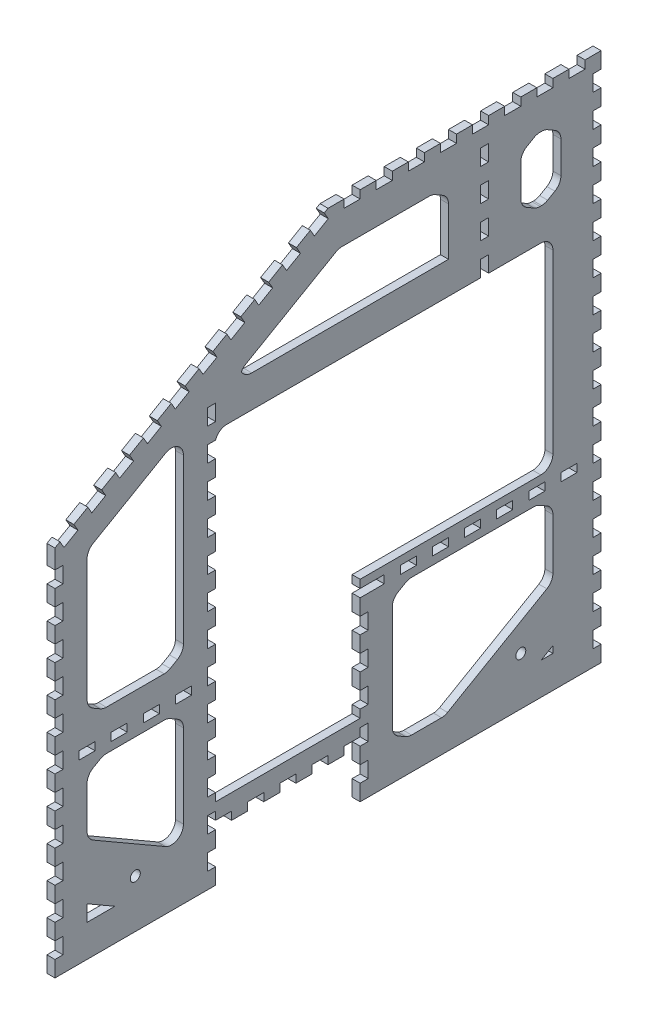
from build123d import *
from OCP.BRepFilletAPI import BRepFilletAPI_MakeChamfer

# Parameters (mm, degrees)
BOSS_EXTRUDE1_DEPTH  = 6.35
SKETCH3_R            = 3.96875
CUT_EXTRUDE1_DEPTH   = 602.77767697
SKETCH5_W            = 6.35
SKETCH5_H            = 12.7
CUT_EXTRUDE3_DEPTH   = 602.77767697
LPATTERN1_COUNT      = 16
LPATTERN1_PITCH      = 25.4
SKETCH6_W            = 6.35
SKETCH6_H            = 12.7
CUT_EXTRUDE4_DEPTH   = 602.77767697
LPATTERN2_COUNT      = 11
LPATTERN2_PITCH      = 25.4
SKETCH7_W            = 6.35
SKETCH7_H            = 12.7
SKETCH7_W_2          = 12.7
SKETCH7_H_2          = 6.35
CUT_EXTRUDE5_DEPTH   = 602.77767697
CUT_EXTRUDE6_DEPTH   = 602.77767697
LPATTERN3_COUNT      = 10
LPATTERN3_PITCH      = 25.4
SKETCH9_W            = 12.7
SKETCH9_H            = 6.35
CUT_EXTRUDE7_DEPTH   = 602.77767697
LPATTERN4_COUNT      = 8
LPATTERN4_PITCH      = 25.4
SKETCH10_R           = 3.175
CUT_EXTRUDE8_DEPTH   = 602.77767697
SKETCH11_R           = 3.96875
CUT_EXTRUDE9_DEPTH   = 602.77767697
SKETCH12_W           = 6.35
SKETCH12_H           = 12.7
CUT_EXTRUDE13_DEPTH  = 602.77767697
SKETCH17_W           = 12.7
SKETCH17_H           = 6.35
CUT_EXTRUDE17_DEPTH  = 602.77767697
LPATTERN5_COUNT      = 17
LPATTERN5_PITCH      = 25.4
LPATTERN6_COUNT      = 2
LPATTERN6_PITCH      = 120.65
SKETCH18_W           = 12.7
SKETCH18_H           = 6.35
CUT_EXTRUDE18_DEPTH  = 602.77767697
LPATTERN7_COUNT      = 5
LPATTERN7_PITCH      = 25.4
CUT_EXTRUDE19_DEPTH  = 602.77767697
SKETCH20_W           = 101.6
SKETCH20_H           = 57.15
CUT_EXTRUDE20_DEPTH  = 602.77767697
CUT_EXTRUDE21_DEPTH  = 602.77767697
CUT_EXTRUDE22_DEPTH  = 602.77767697
SKETCH29_W           = 114.3
SKETCH29_H           = 95.25
CUT_EXTRUDE24_DEPTH  = 602.77767697
SKETCH30_W           = 25.4
SKETCH30_H           = 173.344167394
BOSS_EXTRUDE5_DEPTH  = 6.35
SKETCH31_W           = 6.35
SKETCH31_H           = 12.7
CUT_EXTRUDE25_DEPTH  = 602.77767697
SKETCH33_W           = 114.3
SKETCH33_H           = 12.7
CUT_EXTRUDE27_DEPTH  = 602.77767697
SKETCH34_W           = 114.3
SKETCH34_H           = 12.7
BOSS_EXTRUDE6_DEPTH  = 6.35
SKETCH35_W           = 152.4
SKETCH35_H           = 19.05
CUT_EXTRUDE28_DEPTH  = 602.77767697
BOSS_EXTRUDE8_DEPTH  = 6.35
SKETCH37_W           = 6.35
SKETCH37_H           = 12.7
CUT_EXTRUDE29_DEPTH  = 602.77767697
LPATTERN8_COUNT      = 5
LPATTERN8_PITCH      = 25.4
SKETCH38_W           = 31.75
SKETCH38_H           = 50.8
CUT_EXTRUDE30_DEPTH  = 602.77767697
CHAMFER1_SIZE        = 12.7
CHAMFER1_SIZE2       = 7.332348419
CHAMFER2_SIZE        = 12.7
CHAMFER2_SIZE2       = 7.332348419
BOSS_EXTRUDE9_DEPTH  = 6.35
SKETCH40_W           = 165.1
SKETCH40_H           = 6.35
BOSS_EXTRUDE10_DEPTH = 6.35
SKETCH41_W           = 12.7
SKETCH41_H           = 7.332348419
CUT_EXTRUDE31_DEPTH  = 602.77767697
FILLET1_DEPTH        = 6.35


with BuildPart() as part:
    # Sketch2 → Boss-Extrude1 (new body)
    with BuildSketch(Plane(origin=(0, 0, 0), x_dir=(0, 0, -1), z_dir=(1, 0, 0))):
        Polygon((0, 0), (0, 294.450076882), (215.9, 419.1), (431.8, 419.1), (431.8, 0), (241.3, 0), (241.3, 38.1), (127, 38.1), (127, 0), align=None)
    extrude(amount=BOSS_EXTRUDE1_DEPTH)

    # Sketch3 → Cut-Extrude1 (cut, through all)
    with BuildSketch(Plane(origin=(6.35, 0, 0), x_dir=(0, 0, -1), z_dir=(1, 0, 0))):
        with Locations((63.5, 38.1)):
            Circle(SKETCH3_R)
        with Locations((368.3, 38.1)):
            Circle(SKETCH3_R)
    extrude(amount=-CUT_EXTRUDE1_DEPTH, mode=Mode.SUBTRACT)

    # Sketch5 → Cut-Extrude3 (cut, through all)
    with BuildSketch(Plane(origin=(6.35, 0, 0), x_dir=(0, 0, -1), z_dir=(1, 0, 0))):
        with Locations((428.625, 19.05)):
            Rectangle(SKETCH5_W, SKETCH5_H)
    cut_extrude3 = extrude(amount=-CUT_EXTRUDE3_DEPTH, mode=Mode.SUBTRACT)

    # LPattern1: Cut-Extrude3 ×16
    with Locations(*[(0, i * LPATTERN1_PITCH, 0) for i in range(1, LPATTERN1_COUNT)]):
        add(cut_extrude3, mode=Mode.SUBTRACT)

    # Sketch6 → Cut-Extrude4 (cut, through all)
    with BuildSketch(Plane(origin=(6.35, 0, 0), x_dir=(0, 0, -1), z_dir=(1, 0, 0))):
        with Locations((3.175, 19.05)):
            Rectangle(SKETCH6_W, SKETCH6_H)
    cut_extrude4 = extrude(amount=-CUT_EXTRUDE4_DEPTH, mode=Mode.SUBTRACT)

    # LPattern2: Cut-Extrude4 ×11
    with Locations(*[(0, i * LPATTERN2_PITCH, 0) for i in range(1, LPATTERN2_COUNT)]):
        add(cut_extrude4, mode=Mode.SUBTRACT)

    # Sketch7 → Cut-Extrude5 (cut, through all)
    with BuildSketch(Plane(origin=(6.35, 0, 0), x_dir=(0, 0, -1), z_dir=(1, 0, 0))):
        with Locations((123.825, 19.05)):
            Rectangle(SKETCH7_W, SKETCH7_H)
        with Locations((133.35, 41.275)):
            Rectangle(SKETCH7_W_2, SKETCH7_H_2)
        with Locations((158.75, 41.275)):
            Rectangle(SKETCH7_W_2, SKETCH7_H_2)
        with Locations((184.15, 41.275)):
            Rectangle(SKETCH7_W_2, SKETCH7_H_2)
        with Locations((244.475, 19.05)):
            Rectangle(SKETCH7_W, SKETCH7_H)
        with Locations((209.55, 41.275)):
            Rectangle(SKETCH7_W_2, SKETCH7_H_2)
        with Locations((234.95, 41.275)):
            Rectangle(SKETCH7_W_2, SKETCH7_H_2)
    extrude(amount=-CUT_EXTRUDE5_DEPTH, mode=Mode.SUBTRACT)

    # Sketch8 → Cut-Extrude6 (cut, through all)
    with BuildSketch(Plane(origin=(6.35, 0, 0), x_dir=(0, 0, -1), z_dir=(1, 0, 0))):
        Polygon((201.93507044, 411.037344159), (212.933593068, 417.387344159), (216.108593068, 411.888082845), (205.11007044, 405.538082845), align=None)
    cut_extrude6 = extrude(amount=-CUT_EXTRUDE6_DEPTH, mode=Mode.SUBTRACT)

    # LPattern3: Cut-Extrude6 ×10
    with Locations(*[Vector(0, -0.49999999999999933, 0.866025403784439) * (i * LPATTERN3_PITCH) for i in range(1, LPATTERN3_COUNT)]):
        add(cut_extrude6, mode=Mode.SUBTRACT)

    # Sketch9 → Cut-Extrude7 (cut, through all)
    with BuildSketch(Plane(origin=(6.35, 0, 0), x_dir=(0, 0, -1), z_dir=(1, 0, 0))):
        with Locations((412.75, 415.925)):
            Rectangle(SKETCH9_W, SKETCH9_H)
    cut_extrude7 = extrude(amount=-CUT_EXTRUDE7_DEPTH, mode=Mode.SUBTRACT)

    # LPattern4: Cut-Extrude7 ×8
    with Locations(*[(0, 0, i * LPATTERN4_PITCH) for i in range(1, LPATTERN4_COUNT)]):
        add(cut_extrude7, mode=Mode.SUBTRACT)

    # Sketch10 → Cut-Extrude8 (cut, through all)
    with BuildSketch(Plane(origin=(6.35, 0, 0), x_dir=(0, 0, -1), z_dir=(1, 0, 0))):
        with Locations((222.25, 273.05)):
            Circle(SKETCH10_R)
        with Locations((222.25, 57.15)):
            Circle(SKETCH10_R)
        with Locations((146.05, 57.15)):
            Circle(SKETCH10_R)
        with Locations((146.05, 273.05)):
            Circle(SKETCH10_R)
    extrude(amount=-CUT_EXTRUDE8_DEPTH, mode=Mode.SUBTRACT)

    # Sketch11 → Cut-Extrude9 (cut, through all)
    with BuildSketch(Plane(origin=(6.35, 0, 0), x_dir=(0, 0, -1), z_dir=(1, 0, 0))):
        with Locations((38.1, 260.35)):
            Circle(SKETCH11_R)
        with Locations((266.7, 260.35)):
            Circle(SKETCH11_R)
    extrude(amount=-CUT_EXTRUDE9_DEPTH, mode=Mode.SUBTRACT)

    # Sketch12 → Cut-Extrude13 (cut, through all)
    with BuildSketch(Plane(origin=(6.35, 0, 0), x_dir=(0, 0, -1), z_dir=(1, 0, 0))):
        with Locations((123.825, 44.45)):
            Rectangle(SKETCH12_W, SKETCH12_H)
        with Locations((123.825, 69.85)):
            Rectangle(SKETCH12_W, SKETCH12_H)
        with Locations((123.825, 95.25)):
            Rectangle(SKETCH12_W, SKETCH12_H)
        with Locations((123.825, 120.65)):
            Rectangle(SKETCH12_W, SKETCH12_H)
        with Locations((123.825, 146.05)):
            Rectangle(SKETCH12_W, SKETCH12_H)
        with Locations((123.825, 171.45)):
            Rectangle(SKETCH12_W, SKETCH12_H)
        with Locations((123.825, 196.85)):
            Rectangle(SKETCH12_W, SKETCH12_H)
        with Locations((123.825, 222.25)):
            Rectangle(SKETCH12_W, SKETCH12_H)
        with Locations((123.825, 247.65)):
            Rectangle(SKETCH12_W, SKETCH12_H)
        with Locations((123.825, 273.05)):
            Rectangle(SKETCH12_W, SKETCH12_H)
        with Locations((123.825, 298.45)):
            Rectangle(SKETCH12_W, SKETCH12_H)
        with Locations((123.825, 323.85)):
            Rectangle(SKETCH12_W, SKETCH12_H)
    cut_extrude13 = extrude(amount=-CUT_EXTRUDE13_DEPTH, mode=Mode.SUBTRACT)

    # Sketch17 → Cut-Extrude17 (cut, through all)
    with BuildSketch(Plane(origin=(6.35, 0, 0), x_dir=(0, 0, -1), z_dir=(1, 0, 0))):
        with Locations((25.4, 142.875)):
            Rectangle(SKETCH17_W, SKETCH17_H)
    cut_extrude17 = extrude(amount=-CUT_EXTRUDE17_DEPTH, mode=Mode.SUBTRACT)

    # LPattern5: Cut-Extrude17 ×17
    with Locations(*[(0, 0, -i * LPATTERN5_PITCH) for i in range(1, LPATTERN5_COUNT)]):
        add(cut_extrude17, mode=Mode.SUBTRACT)

    # LPattern6: Cut-Extrude13 ×2
    with Locations(*[(0, 0, -i * LPATTERN6_PITCH) for i in range(1, LPATTERN6_COUNT)]):
        add(cut_extrude13, mode=Mode.SUBTRACT)

    # Sketch18 → Cut-Extrude18 (cut, through all)
    with BuildSketch(Plane(origin=(6.35, 0, 0), x_dir=(0, 0, -1), z_dir=(1, 0, 0))):
        with Locations((133.35, 117.475)):
            Rectangle(SKETCH18_W, SKETCH18_H)
    cut_extrude18 = extrude(amount=-CUT_EXTRUDE18_DEPTH, mode=Mode.SUBTRACT)

    # LPattern7: Cut-Extrude18 ×5
    with Locations(*[(0, 0, -i * LPATTERN7_PITCH) for i in range(1, LPATTERN7_COUNT)]):
        add(cut_extrude18, mode=Mode.SUBTRACT)

    # Sketch19 → Cut-Extrude19 (cut, through all)
    with BuildSketch(Plane(origin=(6.35, 0, 0), x_dir=(0, 0, -1), z_dir=(1, 0, 0))):
        Polygon((25.4, 279.785380045), (222.705909488, 393.7), (393.7, 393.7), (393.7, 165.1), (25.4, 165.1), align=None)
    extrude(amount=-CUT_EXTRUDE19_DEPTH, mode=Mode.SUBTRACT)

    # Sketch20 → Cut-Extrude20 (cut, through all)
    with BuildSketch(Plane(origin=(6.35, 0, 0), x_dir=(0, 0, -1), z_dir=(1, 0, 0))):
        with Locations((184.15, 79.375)):
            Rectangle(SKETCH20_W, SKETCH20_H)
    extrude(amount=-CUT_EXTRUDE20_DEPTH, mode=Mode.SUBTRACT)

    # Sketch21 → Cut-Extrude21 (cut, through all)
    with BuildSketch(Plane(origin=(6.35, 0, 0), x_dir=(0, 0, -1), z_dir=(1, 0, 0))):
        Polygon((266.7, 25.4), (308.202954744, 25.4), (393.7, 74.761742094), (393.7, 133.35), (266.7, 133.35), align=None)
        Polygon((25.4, 133.35), (25.4, 82.094090512), (101.6, 38.1), (101.6, 133.35), align=None)
        Polygon((25.4, 38.1), (25.4, 25.4), (47.397045256, 25.4), align=None)
    extrude(amount=-CUT_EXTRUDE21_DEPTH, mode=Mode.SUBTRACT)

    # Sketch22 → Cut-Extrude22 (cut, through all)
    with BuildSketch(Plane(origin=(6.35, 0, 0), x_dir=(0, 0, -1), z_dir=(1, 0, 0))):
        Polygon((384.402954744, 25.4), (393.7, 30.767651581), (393.7, 25.4), align=None)
    extrude(amount=-CUT_EXTRUDE22_DEPTH, mode=Mode.SUBTRACT)

    # Sketch29 → Cut-Extrude24 (cut, through all)
    with BuildSketch(Plane(origin=(6.35, 0, 0), x_dir=(0, 0, -1), z_dir=(1, 0, 0))):
        with Locations((184.15, 117.475)):
            Rectangle(SKETCH29_W, SKETCH29_H)
    extrude(amount=-CUT_EXTRUDE24_DEPTH, mode=Mode.SUBTRACT)

    # Sketch30 → Boss-Extrude5 (add, through all)
    with BuildSketch(Plane(origin=(6.35, 0, 0), x_dir=(0, 0, -1), z_dir=(1, 0, 0))):
        with Locations((114.3, 251.772083697)):
            Rectangle(SKETCH30_W, SKETCH30_H)
    extrude(amount=-BOSS_EXTRUDE5_DEPTH)

    # Sketch31 → Cut-Extrude25 (cut, through all)
    with BuildSketch(Plane(origin=(6.35, 0, 0), x_dir=(0, 0, -1), z_dir=(1, 0, 0))):
        with Locations((123.825, 171.45)):
            Rectangle(SKETCH31_W, SKETCH31_H)
        with Locations((123.825, 146.05)):
            Rectangle(SKETCH31_W, SKETCH31_H)
        with Locations((123.825, 196.85)):
            Rectangle(SKETCH31_W, SKETCH31_H)
        with Locations((123.825, 222.25)):
            Rectangle(SKETCH31_W, SKETCH31_H)
        with Locations((123.825, 247.65)):
            Rectangle(SKETCH31_W, SKETCH31_H)
        with Locations((123.825, 273.05)):
            Rectangle(SKETCH31_W, SKETCH31_H)
        with Locations((123.825, 298.45)):
            Rectangle(SKETCH31_W, SKETCH31_H)
        with Locations((123.825, 323.85)):
            Rectangle(SKETCH31_W, SKETCH31_H)
    extrude(amount=-CUT_EXTRUDE25_DEPTH, mode=Mode.SUBTRACT)

    # Sketch33 → Cut-Extrude27 (cut, through all)
    with BuildSketch(Plane(origin=(6.35, 0, 0), x_dir=(0, 0, -1), z_dir=(1, 0, 0))):
        with Locations((184.15, 63.5)):
            Rectangle(SKETCH33_W, SKETCH33_H)
    extrude(amount=-CUT_EXTRUDE27_DEPTH, mode=Mode.SUBTRACT)

    # Sketch34 → Boss-Extrude6 (add, through all)
    with BuildSketch(Plane(origin=(6.35, 0, 0), x_dir=(0, 0, -1), z_dir=(1, 0, 0))):
        with Locations((184.15, 50.8)):
            Rectangle(SKETCH34_W, SKETCH34_H)
    extrude(amount=-BOSS_EXTRUDE6_DEPTH)

    # Sketch35 → Cut-Extrude28 (cut, through all)
    with BuildSketch(Plane(origin=(6.35, 0, 0), x_dir=(0, 0, -1), z_dir=(1, 0, 0))):
        with Locations((317.5, 155.575)):
            Rectangle(SKETCH35_W, SKETCH35_H)
    extrude(amount=-CUT_EXTRUDE28_DEPTH, mode=Mode.SUBTRACT)

    # Sketch36 → Boss-Extrude8 (add, through all)
    with BuildSketch(Plane(origin=(6.35, 0, 0), x_dir=(0, 0, -1), z_dir=(1, 0, 0))):
        Polygon((127, 311.15), (393.7, 311.15), (393.7, 393.7), (222.705909488, 393.7), (127, 338.444167394), align=None)
    extrude(amount=-BOSS_EXTRUDE8_DEPTH)

    # Sketch37 → Cut-Extrude29 (cut, through all)
    with BuildSketch(Plane(origin=(6.35, 0, 0), x_dir=(0, 0, -1), z_dir=(1, 0, 0))):
        with Locations((339.725, 393.7)):
            Rectangle(SKETCH37_W, SKETCH37_H)
    cut_extrude29 = extrude(amount=-CUT_EXTRUDE29_DEPTH, mode=Mode.SUBTRACT)

    # LPattern8: Cut-Extrude29 ×5
    with Locations(*[(0, -i * LPATTERN8_PITCH, 0) for i in range(1, LPATTERN8_COUNT)]):
        add(cut_extrude29, mode=Mode.SUBTRACT)

    # Sketch38 → Cut-Extrude30 (cut, through all)
    with BuildSketch(Plane(origin=(6.35, 0, 0), x_dir=(0, 0, -1), z_dir=(1, 0, 0))):
        Polygon((136.419205835, 336.55), (224.40738686, 387.35), (311.15, 387.35), (311.15, 336.55), align=None)
        with Locations((384.175, 361.95)):
            Rectangle(SKETCH38_W, SKETCH38_H)
    extrude(amount=-CUT_EXTRUDE30_DEPTH, mode=Mode.SUBTRACT)

    # Chamfer1: one chamfer whose edges measure the first distance from different faces: ONE call of the kernel's chamfer builder (chamfer() names one face for all edges)
    chamfer1_edges_1 = [part.edges().sort_by_distance(p)[0] for p in [
        (3.175, 133.35, -266.7),
    ]]
    chamfer1_side_1 = [part.faces().sort_by_distance(p)[0] for p in [
        (3.175, 133.35, -330.2),
    ]]
    chamfer1_edges_2 = [part.edges().sort_by_distance(p)[0] for p in [
        (3.175, 133.35, -25.4),
    ]]
    chamfer1_side_2 = [part.faces().sort_by_distance(p)[0] for p in [
        (3.175, 133.35, -63.5),
    ]]
    chamfer1_edges_3 = [part.edges().sort_by_distance(p)[0] for p in [
        (3.175, 165.1, -101.6),
    ]]
    chamfer1_side_3 = [part.faces().sort_by_distance(p)[0] for p in [
        (3.175, 165.1, -63.5),
    ]]
    chamfer1_edges_4 = [part.edges().sort_by_distance(p)[0] for p in [
        (3.175, 336.55, -311.15),
    ]]
    chamfer1_side_4 = [part.faces().sort_by_distance(p)[0] for p in [
        (3.175, 336.55, -223.784602918),
    ]]
    chamfer1_edges_5 = [part.edges().sort_by_distance(p)[0] for p in [
        (3.175, 387.35, -368.3),
    ]]
    chamfer1_side_5 = [part.faces().sort_by_distance(p)[0] for p in [
        (3.175, 387.35, -384.175),
    ]]
    chamfer1_edges_6 = [part.edges().sort_by_distance(p)[0] for p in [
        (3.175, 336.55, -400.05),
    ]]
    chamfer1_side_6 = [part.faces().sort_by_distance(p)[0] for p in [
        (3.175, 336.55, -384.175),
    ]]
    chamfer1 = BRepFilletAPI_MakeChamfer(part.part.solid().wrapped)
    for e in chamfer1_edges_1:
        chamfer1.Add(CHAMFER1_SIZE, CHAMFER1_SIZE2, e.wrapped, chamfer1_side_1[0].wrapped)  # the first distance lies on this face
    for e in chamfer1_edges_2:
        chamfer1.Add(CHAMFER1_SIZE, CHAMFER1_SIZE2, e.wrapped, chamfer1_side_2[0].wrapped)  # the first distance lies on this face
    for e in chamfer1_edges_3:
        chamfer1.Add(CHAMFER1_SIZE, CHAMFER1_SIZE2, e.wrapped, chamfer1_side_3[0].wrapped)  # the first distance lies on this face
    for e in chamfer1_edges_4:
        chamfer1.Add(CHAMFER1_SIZE, CHAMFER1_SIZE2, e.wrapped, chamfer1_side_4[0].wrapped)  # the first distance lies on this face
    for e in chamfer1_edges_5:
        chamfer1.Add(CHAMFER1_SIZE, CHAMFER1_SIZE2, e.wrapped, chamfer1_side_5[0].wrapped)  # the first distance lies on this face
    for e in chamfer1_edges_6:
        chamfer1.Add(CHAMFER1_SIZE, CHAMFER1_SIZE2, e.wrapped, chamfer1_side_6[0].wrapped)  # the first distance lies on this face
    add(Compound.cast(chamfer1.Shape()), mode=Mode.REPLACE)

    # Chamfer2: one chamfer whose edges measure the first distance from different faces: ONE call of the kernel's chamfer builder (chamfer() names one face for all edges)
    chamfer2_edges_1 = [part.edges().sort_by_distance(p)[0] for p in [
        (3.175, 165.1, -25.4),
    ]]
    chamfer2_side_1 = [part.faces().sort_by_distance(p)[0] for p in [
        (3.175, 165.1, -57.15),
    ]]
    chamfer2_edges_2 = [part.edges().sort_by_distance(p)[0] for p in [
        (3.175, 25.4, -266.7),
    ]]
    chamfer2_side_2 = [part.faces().sort_by_distance(p)[0] for p in [
        (3.175, 25.4, -287.451477372),
    ]]
    chamfer2_edges_3 = [part.edges().sort_by_distance(p)[0] for p in [
        (3.175, 133.35, -393.7),
    ]]
    chamfer2_side_3 = [part.faces().sort_by_distance(p)[0] for p in [
        (3.175, 133.35, -336.55),
    ]]
    chamfer2_edges_4 = [part.edges().sort_by_distance(p)[0] for p in [
        (3.175, 133.35, -101.6),
    ]]
    chamfer2_side_4 = [part.faces().sort_by_distance(p)[0] for p in [
        (3.175, 133.35, -69.85),
    ]]
    chamfer2_edges_5 = [part.edges().sort_by_distance(p)[0] for p in [
        (3.175, 387.35, -311.15),
    ]]
    chamfer2_side_5 = [part.faces().sort_by_distance(p)[0] for p in [
        (3.175, 387.35, -267.77869343),
    ]]
    chamfer2_edges_6 = [part.edges().sort_by_distance(p)[0] for p in [
        (3.175, 387.35, -400.05),
    ]]
    chamfer2_side_6 = [part.faces().sort_by_distance(p)[0] for p in [
        (3.175, 387.35, -390.525),
    ]]
    chamfer2_edges_7 = [part.edges().sort_by_distance(p)[0] for p in [
        (3.175, 336.55, -368.3),
    ]]
    chamfer2_side_7 = [part.faces().sort_by_distance(p)[0] for p in [
        (3.175, 336.55, -377.825),
    ]]
    chamfer2 = BRepFilletAPI_MakeChamfer(part.part.solid().wrapped)
    for e in chamfer2_edges_1:
        chamfer2.Add(CHAMFER2_SIZE, CHAMFER2_SIZE2, e.wrapped, chamfer2_side_1[0].wrapped)  # the first distance lies on this face
    for e in chamfer2_edges_2:
        chamfer2.Add(CHAMFER2_SIZE, CHAMFER2_SIZE2, e.wrapped, chamfer2_side_2[0].wrapped)  # the first distance lies on this face
    for e in chamfer2_edges_3:
        chamfer2.Add(CHAMFER2_SIZE, CHAMFER2_SIZE2, e.wrapped, chamfer2_side_3[0].wrapped)  # the first distance lies on this face
    for e in chamfer2_edges_4:
        chamfer2.Add(CHAMFER2_SIZE, CHAMFER2_SIZE2, e.wrapped, chamfer2_side_4[0].wrapped)  # the first distance lies on this face
    for e in chamfer2_edges_5:
        chamfer2.Add(CHAMFER2_SIZE, CHAMFER2_SIZE2, e.wrapped, chamfer2_side_5[0].wrapped)  # the first distance lies on this face
    for e in chamfer2_edges_6:
        chamfer2.Add(CHAMFER2_SIZE, CHAMFER2_SIZE2, e.wrapped, chamfer2_side_6[0].wrapped)  # the first distance lies on this face
    for e in chamfer2_edges_7:
        chamfer2.Add(CHAMFER2_SIZE, CHAMFER2_SIZE2, e.wrapped, chamfer2_side_7[0].wrapped)  # the first distance lies on this face
    add(Compound.cast(chamfer2.Shape()), mode=Mode.REPLACE)

    # Sketch39 → Boss-Extrude9 (add, through all)
    with BuildSketch(Plane(origin=(6.35, 0, 0), x_dir=(0, 0, -1), z_dir=(1, 0, 0))):
        Polygon((146.05, 342.110341604), (146.05, 336.55), (136.419205835, 336.55), align=None)
    extrude(amount=-BOSS_EXTRUDE9_DEPTH)

    # Sketch40 → Boss-Extrude10 (add, through all)
    with BuildSketch(Plane(origin=(6.35, 0, 0), x_dir=(0, 0, -1), z_dir=(1, 0, 0))):
        with Locations((323.85, 149.225)):
            Rectangle(SKETCH40_W, SKETCH40_H)
    extrude(amount=-BOSS_EXTRUDE10_DEPTH)

    # Sketch41 → Cut-Extrude31 (cut, through all)
    with BuildSketch(Plane(origin=(6.35, 0, 0), x_dir=(0, 0, -1), z_dir=(1, 0, 0))):
        with Locations((304.8, 340.21617421)):
            Rectangle(SKETCH41_W, SKETCH41_H)
    extrude(amount=-CUT_EXTRUDE31_DEPTH, mode=Mode.SUBTRACT)

    # Fillet1: read off the stored shape, not the designer's step
    # Fillet1 outline → Fillet1 (add)
    with BuildSketch(Plane.YZ):
        with BuildLine():
            ThreePointArc((374.518390267, -368.3), (379.280890267, -369.576108029), (382.767282238, -373.0625))
            Line((382.767282238, -373.0625), (380.017651581, -368.3))
            Line((380.017651581, -368.3), (374.518390267, -368.3))
        make_face()
        with BuildLine():
            Line((387.35, -381), (386.073891971, -378.789716058))
            ThreePointArc((386.073891971, -378.789716058), (387.025443495, -381.086964653), (387.35, -383.552216058))
            Line((387.35, -383.552216058), (387.35, -381))
        make_face()
        with BuildLine():
            ThreePointArc((341.132717762, -373.0625), (344.619109733, -369.576108029), (349.381609733, -368.3))
            Line((349.381609733, -368.3), (343.882348419, -368.3))
            Line((343.882348419, -368.3), (341.132717762, -373.0625))
        make_face()
        with BuildLine():
            Line((387.35, -387.35), (387.35, -384.797783942))
            ThreePointArc((387.35, -384.797783942), (387.025443495, -387.263035347), (386.073891971, -389.560283942))
            Line((386.073891971, -389.560283942), (387.35, -387.35))
        make_face()
        with BuildLine():
            ThreePointArc((336.55, -383.552216058), (336.874556505, -381.086964653), (337.826108029, -378.789716058))
            Line((337.826108029, -378.789716058), (336.55, -381))
            Line((336.55, -381), (336.55, -383.552216058))
        make_face()
        with BuildLine():
            Line((380.017651581, -400.05), (382.767282238, -395.2875))
            ThreePointArc((382.767282238, -395.2875), (379.280890267, -398.773891971), (374.518390267, -400.05))
            Line((374.518390267, -400.05), (380.017651581, -400.05))
        make_face()
        with BuildLine():
            ThreePointArc((337.826108029, -389.560283942), (336.874556505, -387.263035347), (336.55, -384.797783942))
            Line((336.55, -384.797783942), (336.55, -387.35))
            Line((336.55, -387.35), (337.826108029, -389.560283942))
        make_face()
        with BuildLine():
            Line((343.882348419, -400.05), (349.381609733, -400.05))
            ThreePointArc((349.381609733, -400.05), (344.619109733, -398.773891971), (341.132717762, -395.2875))
            Line((341.132717762, -395.2875), (343.882348419, -400.05))
        make_face()
        with BuildLine():
            ThreePointArc((341.343040145, -147.308550888), (343.333806179, -148.827364739), (344.859972261, -150.8125))
            Line((344.859972261, -150.8125), (342.110341604, -146.05))
            Line((342.110341604, -146.05), (336.55, -146.05))
            Line((336.55, -146.05), (336.55, -155.575))
            ThreePointArc((336.55, -155.575), (337.834928926, -150.79725433), (341.343040145, -147.308550888))
        make_face()
        with BuildLine():
            Line((387.35, -224.40738686), (386.073891971, -222.197102918))
            ThreePointArc((386.073891971, -222.197102918), (387.025443495, -224.494351513), (387.35, -226.959602918))
            Line((387.35, -226.959602918), (387.35, -224.40738686))
        make_face()
        with BuildLine():
            Line((387.35, -298.45), (387.35, -295.897783942))
            ThreePointArc((387.35, -295.897783942), (387.025443495, -298.363035347), (386.073891971, -300.660283942))
            Line((386.073891971, -300.660283942), (387.35, -298.45))
        make_face()
        with BuildLine():
            ThreePointArc((382.767282238, -306.3875), (379.280890267, -309.873891971), (374.518390267, -311.15))
            Line((374.518390267, -311.15), (380.017651581, -311.15))
            Line((380.017651581, -311.15), (382.767282238, -306.3875))
        make_face()
        with BuildLine():
            ThreePointArc((315.530578586, -87.3125), (315.530578586, -96.8375), (307.281686615, -101.6))
            Line((307.281686615, -101.6), (323.779470557, -101.6))
            Line((323.779470557, -101.6), (315.530578586, -87.3125))
        make_face()
        with BuildLine():
            Line((172.432348419, -101.6), (177.931609733, -101.6))
            ThreePointArc((177.931609733, -101.6), (173.169109733, -100.323891971), (169.682717762, -96.8375))
            Line((169.682717762, -96.8375), (172.432348419, -101.6))
        make_face()
        with BuildLine():
            ThreePointArc((274.286118731, -25.4), (279.048618731, -26.676108029), (282.535010702, -30.1625))
            Line((282.535010702, -30.1625), (279.785380045, -25.4))
            Line((279.785380045, -25.4), (274.286118731, -25.4))
        make_face()
        with BuildLine():
            Line((165.1, -88.9), (166.376108029, -91.110283942))
            ThreePointArc((166.376108029, -91.110283942), (165.424556505, -88.813035347), (165.1, -86.347783942))
            Line((165.1, -86.347783942), (165.1, -88.9))
        make_face()
        with BuildLine():
            ThreePointArc((169.682717762, -30.1625), (173.169109733, -26.676108029), (177.931609733, -25.4))
            Line((177.931609733, -25.4), (172.432348419, -25.4))
            Line((172.432348419, -25.4), (169.682717762, -30.1625))
        make_face()
        with BuildLine():
            Line((165.1, -38.1), (165.1, -40.652216058))
            ThreePointArc((165.1, -40.652216058), (165.424556505, -38.186964653), (166.376108029, -35.889716058))
            Line((166.376108029, -35.889716058), (165.1, -38.1))
        make_face()
        with BuildLine():
            Line((38.1, -101.6), (54.597783942, -101.6))
            ThreePointArc((54.597783942, -101.6), (46.348891971, -96.8375), (46.348891971, -87.3125))
            Line((46.348891971, -87.3125), (38.1, -101.6))
        make_face()
        with BuildLine():
            ThreePointArc((128.767282238, -96.8375), (125.280890267, -100.323891971), (120.518390267, -101.6))
            Line((120.518390267, -101.6), (126.017651581, -101.6))
            Line((126.017651581, -101.6), (128.767282238, -96.8375))
        make_face()
        with BuildLine():
            Line((82.094090512, -25.4), (79.344459855, -30.1625))
            ThreePointArc((79.344459855, -30.1625), (82.830851826, -26.676108029), (87.593351826, -25.4))
            Line((87.593351826, -25.4), (82.094090512, -25.4))
        make_face()
        with BuildLine():
            ThreePointArc((133.35, -86.347783942), (133.025443495, -88.813035347), (132.073891971, -91.110283942))
            Line((132.073891971, -91.110283942), (133.35, -88.9))
            Line((133.35, -88.9), (133.35, -86.347783942))
        make_face()
        with BuildLine():
            Line((126.017651581, -25.4), (120.518390267, -25.4))
            ThreePointArc((120.518390267, -25.4), (125.280890267, -26.676108029), (128.767282238, -30.1625))
            Line((128.767282238, -30.1625), (126.017651581, -25.4))
        make_face()
        with BuildLine():
            ThreePointArc((132.073891971, -35.889716058), (133.025443495, -38.186964653), (133.35, -40.652216058))
            Line((133.35, -40.652216058), (133.35, -38.1))
            Line((133.35, -38.1), (132.073891971, -35.889716058))
        make_face()
        with BuildLine():
            Line((74.761742094, -393.7), (80.261003408, -393.7))
            ThreePointArc((80.261003408, -393.7), (75.498503408, -392.423891971), (72.012111437, -388.9375))
            Line((72.012111437, -388.9375), (74.761742094, -393.7))
        make_face()
        with BuildLine():
            ThreePointArc((128.767282238, -388.9375), (125.280890267, -392.423891971), (120.518390267, -393.7))
            Line((120.518390267, -393.7), (126.017651581, -393.7))
            Line((126.017651581, -393.7), (128.767282238, -388.9375))
        make_face()
        with BuildLine():
            Line((25.4, -308.202954744), (26.676108029, -310.413238686))
            ThreePointArc((26.676108029, -310.413238686), (25.724556505, -308.115990091), (25.4, -305.650738686))
            Line((25.4, -305.650738686), (25.4, -308.202954744))
        make_face()
        with BuildLine():
            ThreePointArc((133.35, -378.447783942), (133.025443495, -380.913035347), (132.073891971, -383.210283942))
            Line((132.073891971, -383.210283942), (133.35, -381))
            Line((133.35, -381), (133.35, -378.447783942))
        make_face()
        with BuildLine():
            Line((25.4, -279.4), (25.4, -281.952216058))
            ThreePointArc((25.4, -281.952216058), (25.724556505, -279.486964653), (26.676108029, -277.189716058))
            Line((26.676108029, -277.189716058), (25.4, -279.4))
        make_face()
        with BuildLine():
            ThreePointArc((132.073891971, -277.189716058), (133.025443495, -279.486964653), (133.35, -281.952216058))
            Line((133.35, -281.952216058), (133.35, -279.4))
            Line((133.35, -279.4), (132.073891971, -277.189716058))
        make_face()
        with BuildLine():
            Line((32.732348419, -266.7), (29.982717762, -271.4625))
            ThreePointArc((29.982717762, -271.4625), (33.469109733, -267.976108029), (38.231609733, -266.7))
            Line((38.231609733, -266.7), (32.732348419, -266.7))
        make_face()
        with BuildLine():
            ThreePointArc((120.518390267, -266.7), (125.280890267, -267.976108029), (128.767282238, -271.4625))
            Line((128.767282238, -271.4625), (126.017651581, -266.7))
            Line((126.017651581, -266.7), (120.518390267, -266.7))
        make_face()
        with BuildLine():
            Line((311.15, -127), (304.8, -127))
            ThreePointArc((304.8, -127), (309.402129933, -130.480994807), (311.15, -135.980256121))
            Line((311.15, -135.980256121), (311.15, -127))
        make_face()
        with BuildLine():
            Line((152.4, -393.7), (161.925, -393.7))
            ThreePointArc((161.925, -393.7), (155.189807909, -390.910192091), (152.4, -384.175))
            Line((152.4, -384.175), (152.4, -393.7))
        make_face()
        with BuildLine():
            ThreePointArc((311.15, -384.175), (308.360192091, -390.910192091), (301.625, -393.7))
            Line((301.625, -393.7), (311.15, -393.7))
            Line((311.15, -393.7), (311.15, -384.175))
        make_face()
    extrude(amount=FILLET1_DEPTH)


solid = part.part
